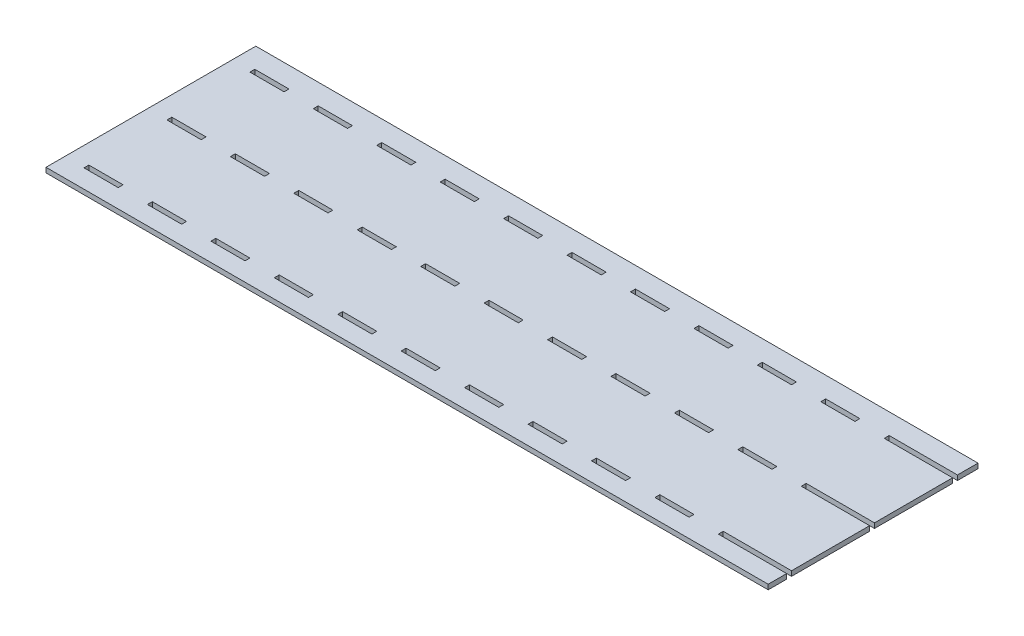
from build123d import *

# Parameters (mm, degrees)
SKETCH1_W               = 939.8
SKETCH1_H               = 273.05
BOSS_EXTRUDE1_DEPTH     = 6.35
CUT_EXTRUDE1_DEPTH      = 979.683127984
CUT_EXTRUDE1_DEPTH_BACK = 979.683127984
SKETCH2_W               = 44.45
SKETCH2_H               = 6.35
SKETCH2_W_2             = 88.9


with BuildPart() as part:
    # Sketch1 → Boss-Extrude1 (new body)
    with BuildSketch(Plane(origin=(0, 0, 0), x_dir=(1, 0, 0), z_dir=(0, 1, 0))):
        with Locations((469.9, -136.525)):
            Rectangle(SKETCH1_W, SKETCH1_H)
    extrude(amount=BOSS_EXTRUDE1_DEPTH)

    # Sketch2 → Cut-Extrude1 (cut, two sides: drawn at the far end of the back side and taken through both)
    with BuildSketch(Plane(origin=(0, 6.35, 0), x_dir=(1, 0, 0), z_dir=(0, 1, 0)).offset(-CUT_EXTRUDE1_DEPTH_BACK)):
        with Locations((47.625, -29.913697199)):
            Rectangle(SKETCH2_W, SKETCH2_H)
        with Locations((130.175, -29.913697199)):
            Rectangle(SKETCH2_W, SKETCH2_H)
        with Locations((212.725, -29.913697199)):
            Rectangle(SKETCH2_W, SKETCH2_H)
        with Locations((295.275, -29.913697199)):
            Rectangle(SKETCH2_W, SKETCH2_H)
        with Locations((377.825, -29.913697199)):
            Rectangle(SKETCH2_W, SKETCH2_H)
        with Locations((460.375, -29.913697199)):
            Rectangle(SKETCH2_W, SKETCH2_H)
        with Locations((542.925, -29.913697199)):
            Rectangle(SKETCH2_W, SKETCH2_H)
        with Locations((625.475, -29.913697199)):
            Rectangle(SKETCH2_W, SKETCH2_H)
        with Locations((708.025, -29.913697199)):
            Rectangle(SKETCH2_W, SKETCH2_H)
        with Locations((790.575, -29.913697199)):
            Rectangle(SKETCH2_W, SKETCH2_H)
        with Locations((130.175, -137.863697199)):
            Rectangle(SKETCH2_W, SKETCH2_H)
        with Locations((212.725, -137.863697199)):
            Rectangle(SKETCH2_W, SKETCH2_H)
        with Locations((295.275, -137.863697199)):
            Rectangle(SKETCH2_W, SKETCH2_H)
        with Locations((377.825, -137.863697199)):
            Rectangle(SKETCH2_W, SKETCH2_H)
        with Locations((460.375, -137.863697199)):
            Rectangle(SKETCH2_W, SKETCH2_H)
        with Locations((542.925, -137.863697199)):
            Rectangle(SKETCH2_W, SKETCH2_H)
        with Locations((625.475, -137.863697199)):
            Rectangle(SKETCH2_W, SKETCH2_H)
        with Locations((708.025, -137.863697199)):
            Rectangle(SKETCH2_W, SKETCH2_H)
        with Locations((790.575, -137.863697199)):
            Rectangle(SKETCH2_W, SKETCH2_H)
        with Locations((130.175, -245.813697199)):
            Rectangle(SKETCH2_W, SKETCH2_H)
        with Locations((212.725, -245.813697199)):
            Rectangle(SKETCH2_W, SKETCH2_H)
        with Locations((295.275, -245.813697199)):
            Rectangle(SKETCH2_W, SKETCH2_H)
        with Locations((377.825, -245.813697199)):
            Rectangle(SKETCH2_W, SKETCH2_H)
        with Locations((460.375, -245.813697199)):
            Rectangle(SKETCH2_W, SKETCH2_H)
        with Locations((542.925, -245.813697199)):
            Rectangle(SKETCH2_W, SKETCH2_H)
        with Locations((625.475, -245.813697199)):
            Rectangle(SKETCH2_W, SKETCH2_H)
        with Locations((708.025, -245.813697199)):
            Rectangle(SKETCH2_W, SKETCH2_H)
        with Locations((790.575, -245.813697199)):
            Rectangle(SKETCH2_W, SKETCH2_H)
        with Locations((47.625, -137.863697199)):
            Rectangle(SKETCH2_W, SKETCH2_H)
        with Locations((47.625, -245.813697199)):
            Rectangle(SKETCH2_W, SKETCH2_H)
        with Locations((895.35, -137.863697199)):
            Rectangle(SKETCH2_W_2, SKETCH2_H)
        with Locations((895.35, -29.913697199)):
            Rectangle(SKETCH2_W_2, SKETCH2_H)
        with Locations((895.35, -245.813697199)):
            Rectangle(SKETCH2_W_2, SKETCH2_H)
    extrude(amount=CUT_EXTRUDE1_DEPTH + CUT_EXTRUDE1_DEPTH_BACK, mode=Mode.SUBTRACT)


solid = part.part
